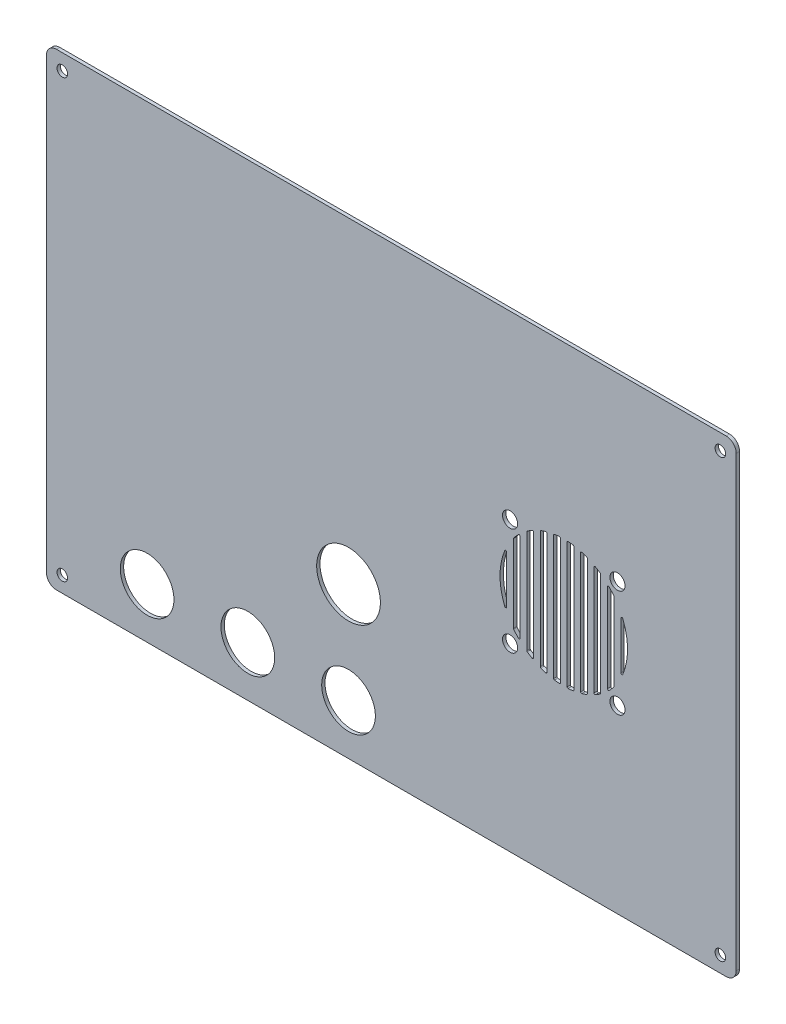
from build123d import *

# Parameters (mm, degrees)
SKETCH_2_W             = 205.5
SKETCH_2_H             = 139.5
SM_BASE_FLANGE_1_DEPTH = 1
FILLET_1_R             = 3
HOLE_WIZARD_M31_D      = 3.15
HOLE_WIZARD_M31_DEPTH  = 8.5
HOLE_WIZARD_M31_TIP    = 0.946355475
SKETCH_9_R             = 2.25
CUT_EXTRUDE_3_DEPTH    = 1
CUT_EXTRUDE_4_DEPTH    = 1
SKETCH_8_R             = 8
CUT_EXTRUDE_1_DEPTH    = 10
SKETCH_10_R            = 9.5
CUT_EXTRUDE_2_DEPTH    = 1
FILLET_2_R             = 0.3


# Sheet-metal steps are written as plain solids
with BuildPart() as part:
    # Sketch 2 → Базовая кромка1 (new body)
    with BuildSketch(Plane.XY):
        Rectangle(SKETCH_2_W, SKETCH_2_H)
    extrude(amount=-SM_BASE_FLANGE_1_DEPTH)

    # Скругление1
    fillet_1_edges = [part.edges().sort_by_distance(p)[0] for p in [
        (-102.75, 69.75, -0.5),
        (102.75, 69.75, -0.5),
        (102.75, -69.75, -0.5),
        (-102.75, -69.75, -0.5),
    ]]
    fillet(fillet_1_edges, radius=FILLET_1_R)

    # Сверло под метчик  спиральное M31
    with Locations(Plane(origin=(0, 0, -1), x_dir=(-1, 0, 0), z_dir=(0, 0, -1))):
        with Locations((-98.021320344, 65.021320344), (98.021320344, 65.021320344), (98.021320344, -65.021320344), (-98.021320344, -65.021320344)):
            Hole(HOLE_WIZARD_M31_D / 2, depth=HOLE_WIZARD_M31_DEPTH)
            with Locations((0, 0, -(HOLE_WIZARD_M31_DEPTH + HOLE_WIZARD_M31_TIP / 2))):  # 118° drill point
                Cone(0, HOLE_WIZARD_M31_D / 2, HOLE_WIZARD_M31_TIP, mode=Mode.SUBTRACT)

    # Эскиз9 → Вырез-Вытянуть3 (cut)
    with BuildSketch(Plane(origin=(0, 0, -1), x_dir=(-1, 0, 0), z_dir=(0, 0, -1))):
        with Locations((-67.375, 16)):
            Circle(SKETCH_9_R)
        with Locations((-35.375, 16)):
            Circle(SKETCH_9_R)
        with Locations((-35.375, -16)):
            Circle(SKETCH_9_R)
        with Locations((-67.375, -16)):
            Circle(SKETCH_9_R)
    extrude(amount=-CUT_EXTRUDE_3_DEPTH, mode=Mode.SUBTRACT)

    # Эскиз11 → Вырез-Вытянуть4 (cut)
    with BuildSketch(Plane(origin=(0, 0, -1), x_dir=(-1, 0, 0), z_dir=(0, 0, -1))):
        with BuildLine():
            Line((-68.375, 8.485281374), (-68.375, -8.485281374))
            ThreePointArc((-68.375, -8.485281374), (-70.375, 0), (-68.375, 8.485281374))
        make_face()
        with BuildLine():
            Line((-66.375, 11.66190379), (-66.375, -11.66190379))
            ThreePointArc((-66.375, -11.66190379), (-65.41793276, -12.798282678), (-64.375, -13.856406461))
            Line((-64.375, -13.856406461), (-64.375, 13.856406461))
            ThreePointArc((-64.375, 13.856406461), (-65.41793276, 12.798282678), (-66.375, 11.66190379))
        make_face()
        with BuildLine():
            Line((-52.375, 18.973665961), (-52.375, -18.973665961))
            ThreePointArc((-52.375, -18.973665961), (-53.377807107, -18.894146281), (-54.375, -18.761663039))
            Line((-54.375, -18.761663039), (-54.375, 18.761663039))
            ThreePointArc((-54.375, 18.761663039), (-53.377807107, 18.894146281), (-52.375, 18.973665961))
        make_face()
        with BuildLine():
            Line((-56.375, 18.33030278), (-56.375, -18.33030278))
            ThreePointArc((-56.375, -18.33030278), (-57.384255298, -18.024673388), (-58.375, -17.663521733))
            Line((-58.375, -17.663521733), (-58.375, 17.663521733))
            ThreePointArc((-58.375, 17.663521733), (-57.384255298, 18.024673388), (-56.375, 18.33030278))
        make_face()
        with BuildLine():
            Line((-60.375, 16.733200531), (-60.375, -16.733200531))
            ThreePointArc((-60.375, -16.733200531), (-61.394240791, -16.143568811), (-62.375, -15.491933385))
            Line((-62.375, -15.491933385), (-62.375, 15.491933385))
            ThreePointArc((-62.375, 15.491933385), (-61.394240791, 16.143568811), (-60.375, 16.733200531))
        make_face()
        with BuildLine():
            Line((-40.375, 15.491933385), (-40.375, -15.491933385))
            ThreePointArc((-40.375, -15.491933385), (-41.355759209, -16.143568811), (-42.375, -16.733200531))
            Line((-42.375, -16.733200531), (-42.375, 16.733200531))
            ThreePointArc((-42.375, 16.733200531), (-41.355759209, 16.143568811), (-40.375, 15.491933385))
        make_face()
        with BuildLine():
            Line((-44.375, 17.663521733), (-44.375, -17.663521733))
            ThreePointArc((-44.375, -17.663521733), (-45.365744702, -18.024673388), (-46.375, -18.33030278))
            Line((-46.375, -18.33030278), (-46.375, 18.33030278))
            ThreePointArc((-46.375, 18.33030278), (-45.365744702, 18.024673388), (-44.375, 17.663521733))
        make_face()
        with BuildLine():
            Line((-48.375, 18.761663039), (-48.375, -18.761663039))
            ThreePointArc((-48.375, -18.761663039), (-49.372192893, -18.894146281), (-50.375, -18.973665961))
            Line((-50.375, -18.973665961), (-50.375, 18.973665961))
            ThreePointArc((-50.375, 18.973665961), (-49.372192893, 18.894146281), (-48.375, 18.761663039))
        make_face()
        with BuildLine():
            Line((-38.375, 13.856406461), (-38.375, -13.856406461))
            ThreePointArc((-38.375, -13.856406461), (-37.33206724, -12.798282678), (-36.375, -11.66190379))
            Line((-36.375, -11.66190379), (-36.375, 11.66190379))
            ThreePointArc((-36.375, 11.66190379), (-37.33206724, 12.798282678), (-38.375, 13.856406461))
        make_face()
        with BuildLine():
            Line((-34.375, 8.485281374), (-34.375, -8.485281374))
            ThreePointArc((-34.375, -8.485281374), (-32.375, 0), (-34.375, 8.485281374))
        make_face()
    extrude(amount=-CUT_EXTRUDE_4_DEPTH, mode=Mode.SUBTRACT)

    # Эскиз8 → Вырез-Вытянуть1 (cut)
    with BuildSketch(Plane(origin=(0, 0, -1), x_dir=(-1, 0, 0), z_dir=(0, 0, -1))):
        with Locations((42.75, -54.75)):
            Circle(SKETCH_8_R)
        with Locations((72.75, -54.75)):
            Circle(SKETCH_8_R)
        with Locations((12.75, -54.75)):
            Circle(SKETCH_8_R)
    extrude(amount=-CUT_EXTRUDE_1_DEPTH, mode=Mode.SUBTRACT)

    # Эскиз10 → Вырез-Вытянуть2 (cut)
    with BuildSketch(Plane(origin=(0, 0, -1), x_dir=(-1, 0, 0), z_dir=(0, 0, -1))):
        with Locations((12.75, -24.75)):
            Circle(SKETCH_10_R)
    extrude(amount=-CUT_EXTRUDE_2_DEPTH, mode=Mode.SUBTRACT)

    # Скругление2
    fillet_2_edges = [part.edges().sort_by_distance(p)[0] for p in [
        (34.375, 8.485281374, -0.5),
        (34.375, -8.485281374, -0.5),
        (68.375, -8.485281374, -0.5),
        (68.375, 8.485281374, -0.5),
        (66.375, 11.66190379, -0.5),
        (64.375, 13.856406461, -0.5),
        (64.375, -13.856406461, -0.5),
        (66.375, -11.66190379, -0.5),
        (54.375, 18.761663039, -0.5),
        (52.375, 18.973665961, -0.5),
        (52.375, -18.973665961, -0.5),
        (54.375, -18.761663039, -0.5),
        (58.375, 17.663521733, -0.5),
        (56.375, 18.33030278, -0.5),
        (56.375, -18.33030278, -0.5),
        (58.375, -17.663521733, -0.5),
        (62.375, 15.491933385, -0.5),
        (60.375, 16.733200531, -0.5),
        (60.375, -16.733200531, -0.5),
        (62.375, -15.491933385, -0.5),
        (44.375, -17.663521733, -0.5),
        (46.375, -18.33030278, -0.5),
        (46.375, 18.33030278, -0.5),
        (44.375, 17.663521733, -0.5),
        (40.375, -15.491933385, -0.5),
        (42.375, -16.733200531, -0.5),
        (42.375, 16.733200531, -0.5),
        (40.375, 15.491933385, -0.5),
        (36.375, -11.66190379, -0.5),
        (38.375, -13.856406461, -0.5),
        (38.375, 13.856406461, -0.5),
        (36.375, 11.66190379, -0.5),
        (48.375, -18.761663039, -0.5),
        (50.375, -18.973665961, -0.5),
        (50.375, 18.973665961, -0.5),
        (48.375, 18.761663039, -0.5),
    ]]
    fillet(fillet_2_edges, radius=FILLET_2_R)


solid = part.part
